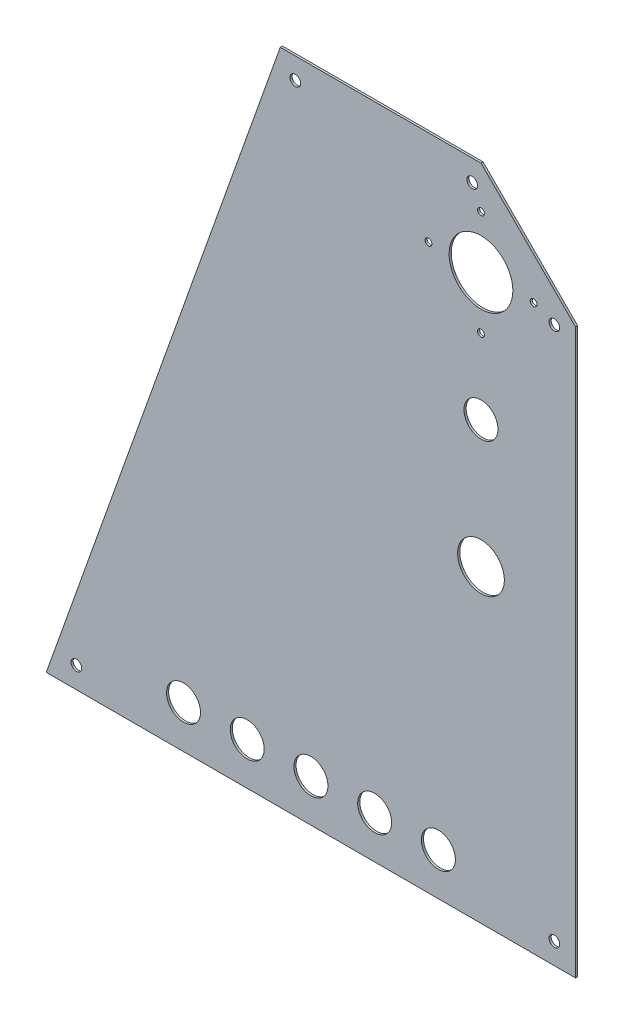
from build123d import *

# Parameters (mm, degrees)
SKETCH1_W           = 310
SKETCH1_H           = 250
BOSS_EXTRUDE1_DEPTH = 1
SKETCH2_OUTSIDE_W   = 391.65
SKETCH2_OUTSIDE_H   = 331.65
CUT_EXTRUDE1_DEPTH  = 200.125588511
SKETCH3_R           = 15
SKETCH3_R_2         = 8
SKETCH3_R_3         = 11
SKETCH3_R_4         = 1.6
CUT_EXTRUDE2_DEPTH  = 200.125588511
SKETCH4_R           = 8
CUT_EXTRUDE3_DEPTH  = 200.125588511
SKETCH5_R           = 2.5
CUT_EXTRUDE4_DEPTH  = 200.125588511


with BuildPart() as part:
    # Sketch1 → Boss-Extrude1 (new body)
    with BuildSketch(Plane(origin=(0, 0, 0), x_dir=(0, 1, 0), z_dir=(0, 0, 1))):
        Rectangle(SKETCH1_W, SKETCH1_H)
    extrude(amount=BOSS_EXTRUDE1_DEPTH)

    # Sketch2 outside → Cut-Extrude1 (cut, through all)
    with BuildSketch(Plane(origin=(0, 0, 1), x_dir=(0, -1, 0), z_dir=(0, 0, 1))):
        Rectangle(SKETCH2_OUTSIDE_W, SKETCH2_OUTSIDE_H)
        Polygon((-155, -14.047727215), (155, -124.233933248), (155, 125), (-110.452272785, 125), (-155, 80.452272785), align=None, mode=Mode.SUBTRACT)
    extrude(amount=-CUT_EXTRUDE1_DEPTH, mode=Mode.SUBTRACT)

    # Sketch3 → Cut-Extrude2 (cut, through all)
    with BuildSketch(Plane(origin=(0, 0, 1), x_dir=(0, -1, 0), z_dir=(0, 0, 1))):
        with Locations((-110.452272785, 80.452272785)):
            Circle(SKETCH3_R)
        with Locations((-50.452272785, 80.452272785)):
            Circle(SKETCH3_R_2)
        with Locations((9.547727215, 80.452272785)):
            Circle(SKETCH3_R_3)
        with Locations((-110.452272785, 55.703535444)):
            Circle(SKETCH3_R_4)
        with Locations((-135.201010127, 80.452272785)):
            Circle(SKETCH3_R_4)
        with Locations((-110.452272785, 105.201010127)):
            Circle(SKETCH3_R_4)
        with Locations((-85.703535444, 80.452272785)):
            Circle(SKETCH3_R_4)
    extrude(amount=-CUT_EXTRUDE2_DEPTH, mode=Mode.SUBTRACT)

    # Sketch4 → Cut-Extrude3 (cut, through all)
    with BuildSketch(Plane(origin=(0, 0, 1), x_dir=(0, -1, 0), z_dir=(0, 0, 1))):
        with Locations((135, -59.616966624)):
            Circle(SKETCH4_R)
        with Locations((135, -29.616966624)):
            Circle(SKETCH4_R)
        with Locations((135, 0.383033376)):
            Circle(SKETCH4_R)
        with Locations((135, 30.383033376)):
            Circle(SKETCH4_R)
        with Locations((135, 60.383033376)):
            Circle(SKETCH4_R)
    extrude(amount=-CUT_EXTRUDE3_DEPTH, mode=Mode.SUBTRACT)

    # Sketch5 → Cut-Extrude4 (cut, through all)
    with BuildSketch(Plane(origin=(0, 0, 1), x_dir=(0, -1, 0), z_dir=(0, 0, 1))):
        with Locations((145, -110.066636279)):
            Circle(SKETCH5_R)
        with Locations((-145, -6.989217732)):
            Circle(SKETCH5_R)
        with Locations((-145, 76.310137162)):
            Circle(SKETCH5_R)
        with Locations((145, 115)):
            Circle(SKETCH5_R)
        with Locations((-106.310137162, 115)):
            Circle(SKETCH5_R)
    extrude(amount=-CUT_EXTRUDE4_DEPTH, mode=Mode.SUBTRACT)


solid = part.part
